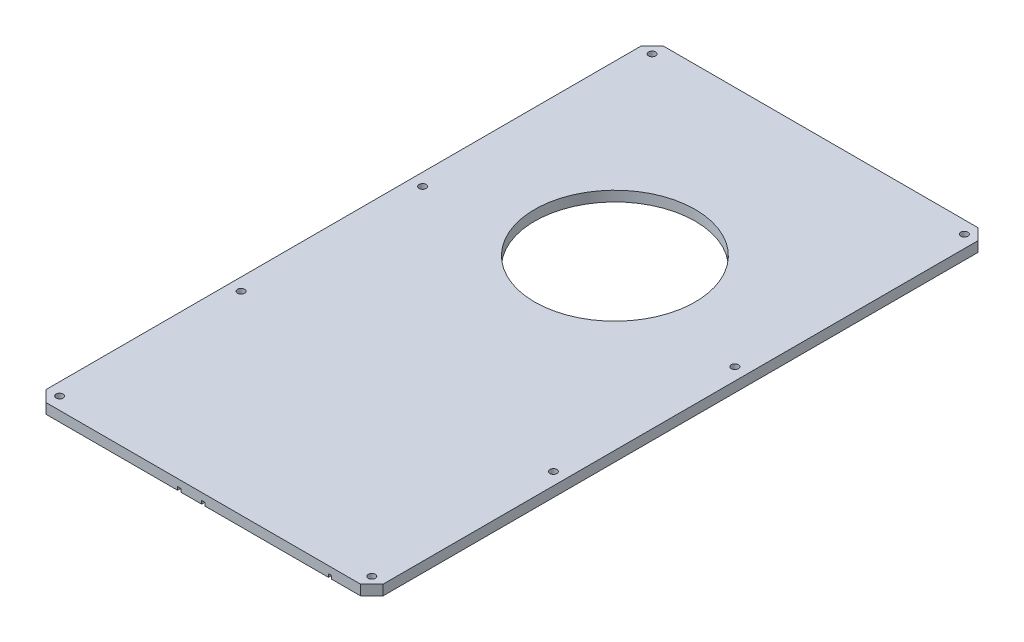
from build123d import *

# Parameters (mm, degrees)
SKETCH1_W               = 105
SKETCH1_H               = 192.3454
BOSS_EXTRUDE1_DEPTH     = 3.175
CHAMFER1_SIZE           = 3.5
SKETCH2_R               = 25
CUT_EXTRUDE1_DEPTH      = 110.615322151
CUT_EXTRUDE_THIN1_START = -1
CUT_EXTRUDE_THIN1_DEPTH = 1
CUT_EXTRUDE2_DEPTH      = 1
SKETCH6_R               = 1.1
CUT_EXTRUDE3_DEPTH      = 110.615322151
CHAMFER2_SIZE           = 1.1


# Read off the part's stored shape, not the designer's step: Cut-Extrude-Thin1
with BuildPart() as part:
    # Sketch1 → Boss-Extrude1 (new body)
    with BuildSketch(Plane(origin=(0, 0, 0), x_dir=(1, 0, 0), z_dir=(0, 1, 0))):
        Rectangle(SKETCH1_W, SKETCH1_H)
    extrude(amount=BOSS_EXTRUDE1_DEPTH)

    # Chamfer1
    chamfer1_edges = [part.edges().sort_by_distance(p)[0] for p in [
        (-52.5, 1.5875, -96.1727),
        (52.5, 1.5875, -96.1727),
        (52.5, 1.5875, 96.1727),
        (-52.5, 1.5875, 96.1727),
    ]]
    chamfer(chamfer1_edges, length=CHAMFER1_SIZE)

    # Sketch2 → Cut-Extrude1 (cut, through all)
    with BuildSketch(Plane.XZ):
        with Locations(Location((0, -32.057566667, 0), (0, 0, 270))):
            Circle(SKETCH2_R)
    extrude(amount=-CUT_EXTRUDE1_DEPTH, mode=Mode.SUBTRACT)

    # Cut-Extrude-Thin1 outline → Cut-Extrude-Thin1 (cut)
    # profile 1 of 2: a face of its own
    with BuildSketch(Plane(origin=(0, 0, 0), x_dir=(-1, 0, 0), z_dir=(0, -1, 0)).offset(CUT_EXTRUDE_THIN1_START)):
        with BuildLine():
            Line((-0.5, 7.062567167), (-0.5, -10.4787141))
            ThreePointArc((-0.5, -10.4787141), (-6.237149669, -19.303333464), (-7.980739941, -29.683539926))
            ThreePointArc((-7.980739941, -29.683539926), (0, -26.804235846), (7.980739941, -29.683539926))
            ThreePointArc((7.980739941, -29.683539926), (6.237149669, -19.303333464), (0.5, -10.4787141))
            Line((0.5, -10.4787141), (0.5, 7.062567167))
            ThreePointArc((0.5, 7.062567167), (0, 7.057566667), (-0.5, 7.062567167))
        make_face()
        with BuildLine():
            ThreePointArc((0, -11.397130906), (5.003923805, -18.927747814), (6.982377972, -27.750171719))
            ThreePointArc((6.982377972, -27.750171719), (0, -25.804235846), (-6.982377972, -27.750171719))
            ThreePointArc((-6.982377972, -27.750171719), (-5.003923805, -18.927747814), (0, -11.397130906))
        make_face(mode=Mode.SUBTRACT)
    # profile 2 of 2: a face of its own
    with BuildSketch(Plane(origin=(0, 0, 0), x_dir=(-1, 0, 0), z_dir=(0, -1, 0)).offset(CUT_EXTRUDE_THIN1_START)):
        with BuildLine():
            ThreePointArc((-3.461538462, -73.83767702), (-2.032623324, -72.965633547), (-0.5, -72.292340123))
            Line((-0.5, -72.292340123), (-0.5, -96.1727))
            Line((-0.5, -96.1727), (0.5, -96.1727))
            Line((0.5, -96.1727), (0.5, -89.050988889))
            Line((0.5, -89.050988889), (5.5, -89.050988889))
            Line((5.5, -89.050988889), (5.5, -88.050988889))
            Line((5.5, -88.050988889), (0.5, -88.050988889))
            Line((0.5, -88.050988889), (0.5, -71.977550364))
            ThreePointArc((0.5, -71.977550364), (3.75, -71.547658069), (7, -71.977550364))
            Line((7, -71.977550364), (7, -96.1727))
            Line((7, -96.1727), (8, -96.1727))
            Line((8, -96.1727), (8, -81.550988889))
            Line((8, -81.550988889), (32.5, -81.550988889))
            Line((32.5, -81.550988889), (32.5, 13.3273))
            Line((32.5, 13.3273), (39, 13.3273))
            Line((39, 13.3273), (39, -88.050988889))
            Line((39, -88.050988889), (9.5, -88.050988889))
            Line((9.5, -88.050988889), (9.5, -89.050988889))
            Line((9.5, -89.050988889), (40, -89.050988889))
            Line((40, -89.050988889), (40, 13.3273))
            Line((40, 13.3273), (43.75, 13.3273))
            Line((43.75, 13.3273), (43.75, 24.3273))
            ThreePointArc((43.75, 24.3273), (41.580951895, 29.804525575), (36.25, 32.311659711))
            Line((36.25, 32.311659711), (36.25, 63.444142327))
            Line((36.25, 63.444142327), (4.25, 63.444142327))
            Line((4.25, 63.444142327), (4.25, 68.752070988))
            ThreePointArc((4.25, 68.752070988), (6.207809813, 67.846319731), (7.980739941, 66.617448963))
            ThreePointArc((7.980739941, 66.617448963), (6.237149669, 76.997655425), (0.5, 85.822274789))
            Line((0.5, 85.822274789), (0.5, 96.1727))
            Line((0.5, 96.1727), (-0.5, 96.1727))
            Line((-0.5, 96.1727), (-0.5, 85.822274789))
            ThreePointArc((-0.5, 85.822274789), (-6.237149669, 76.997655425), (-7.980739941, 66.617448963))
            ThreePointArc((-7.980739941, 66.617448963), (-6.207809813, 67.846319731), (-4.25, 68.752070988))
            Line((-4.25, 68.752070988), (-4.25, 63.444142327))
            Line((-4.25, 63.444142327), (-36.25, 63.444142327))
            Line((-36.25, 63.444142327), (-36.25, 32.311659711))
            ThreePointArc((-36.25, 32.311659711), (-41.580951895, 29.804525575), (-43.75, 24.3273))
            Line((-43.75, 24.3273), (-43.75, 13.3273))
            Line((-43.75, 13.3273), (-40, 13.3273))
            Line((-40, 13.3273), (-40, -96.1727))
            Line((-40, -96.1727), (-39, -96.1727))
            Line((-39, -96.1727), (-39, -38.185855556))
            Line((-39, -38.185855556), (-3.25, -38.185855556))
            Line((-3.25, -38.185855556), (-3.25, -29.234128142))
            ThreePointArc((-3.25, -29.234128142), (0, -28.804235846), (3.25, -29.234128142))
            Line((3.25, -29.234128142), (3.25, -44.685855556))
            Line((3.25, -44.685855556), (-31.5, -44.685855556))
            Line((-31.5, -44.685855556), (-31.5, -39.685855556))
            Line((-31.5, -39.685855556), (-32.5, -39.685855556))
            Line((-32.5, -39.685855556), (-32.5, -45.685855556))
            Line((-32.5, -45.685855556), (3.25, -45.685855556))
            Line((3.25, -45.685855556), (3.25, -53.222136322))
            ThreePointArc((3.25, -53.222136322), (-2.487149669, -62.046755686), (-4.230739941, -72.426962148))
            ThreePointArc((-4.230739941, -72.426962148), (3.75, -69.547658069), (11.730739941, -72.426962148))
            ThreePointArc((11.730739941, -72.426962148), (9.987149669, -62.046755686), (4.25, -53.222136322))
            Line((4.25, -53.222136322), (4.25, -29.548917901))
            ThreePointArc((4.25, -29.548917901), (5.782623324, -30.222211325), (7.211538462, -31.094254798))
            Line((7.211538462, -31.094254798), (7.788461538, -30.277456314))
            ThreePointArc((7.788461538, -30.277456314), (0, -27.804235846), (-7.788461538, -30.277456314))
            Line((-7.788461538, -30.277456314), (-7.211538462, -31.094254798))
            ThreePointArc((-7.211538462, -31.094254798), (-5.782623324, -30.222211325), (-4.25, -29.548917901))
            Line((-4.25, -29.548917901), (-4.25, -37.185855556))
            Line((-4.25, -37.185855556), (-39, -37.185855556))
            Line((-39, -37.185855556), (-39, 13.3273))
            Line((-39, 13.3273), (-32.5, 13.3273))
            Line((-32.5, 13.3273), (-32.5, -35.685855556))
            Line((-32.5, -35.685855556), (-31.5, -35.685855556))
            Line((-31.5, -35.685855556), (-31.5, 13.3273))
            Line((-31.5, 13.3273), (-27.75, 13.3273))
            Line((-27.75, 13.3273), (-27.75, 24.3273))
            ThreePointArc((-27.75, 24.3273), (-29.919048105, 29.804525575), (-35.25, 32.311659711))
            Line((-35.25, 32.311659711), (-35.25, 62.444142327))
            Line((-35.25, 62.444142327), (-3.25, 62.444142327))
            Line((-3.25, 62.444142327), (-3.25, 69.066860747))
            ThreePointArc((-3.25, 69.066860747), (0, 69.496753043), (3.25, 69.066860747))
            Line((3.25, 69.066860747), (3.25, 62.444142327))
            Line((3.25, 62.444142327), (35.25, 62.444142327))
            Line((35.25, 62.444142327), (35.25, 32.311659711))
            ThreePointArc((35.25, 32.311659711), (29.919048105, 29.804525575), (27.75, 24.3273))
            Line((27.75, 24.3273), (27.75, 13.3273))
            Line((27.75, 13.3273), (31.5, 13.3273))
            Line((31.5, 13.3273), (31.5, -80.550988889))
            Line((31.5, -80.550988889), (8, -80.550988889))
            Line((8, -80.550988889), (8, -72.292340123))
            ThreePointArc((8, -72.292340123), (9.532623324, -72.965633547), (10.961538462, -73.83767702))
            Line((10.961538462, -73.83767702), (11.538461538, -73.020878536))
            ThreePointArc((11.538461538, -73.020878536), (3.75, -70.547658069), (-4.038461538, -73.020878536))
            Line((-4.038461538, -73.020878536), (-3.461538462, -73.83767702))
        make_face()
        with BuildLine():
            ThreePointArc((3.75, -54.140553128), (8.753923805, -61.671170036), (10.732377972, -70.493593942))
            ThreePointArc((10.732377972, -70.493593942), (3.75, -68.547658069), (-3.232377972, -70.493593942))
            ThreePointArc((-3.232377972, -70.493593942), (-1.253923805, -61.671170036), (3.75, -54.140553128))
        make_face(mode=Mode.SUBTRACT)
        with BuildLine():
            Line((-28.75, 14.3273), (-42.75, 14.3273))
            Line((-42.75, 14.3273), (-42.75, 24.3273))
            ThreePointArc((-42.75, 24.3273), (-35.75, 31.3273), (-28.75, 24.3273))
            Line((-28.75, 24.3273), (-28.75, 14.3273))
        make_face(mode=Mode.SUBTRACT)
        with BuildLine():
            ThreePointArc((28.75, 24.3273), (35.75, 31.3273), (42.75, 24.3273))
            Line((42.75, 24.3273), (42.75, 14.3273))
            Line((42.75, 14.3273), (28.75, 14.3273))
            Line((28.75, 14.3273), (28.75, 24.3273))
        make_face(mode=Mode.SUBTRACT)
        with BuildLine():
            ThreePointArc((0, 84.903857983), (5.003923805, 77.373241075), (6.982377972, 68.55081717))
            ThreePointArc((6.982377972, 68.55081717), (0, 70.496753043), (-6.982377972, 68.55081717))
            ThreePointArc((-6.982377972, 68.55081717), (-5.003923805, 77.373241075), (0, 84.903857983))
        make_face(mode=Mode.SUBTRACT)
    extrude(amount=CUT_EXTRUDE_THIN1_DEPTH, mode=Mode.SUBTRACT)

    # Sketch4 → Cut-Extrude2 (cut)
    with BuildSketch(Plane.XZ):
        with BuildLine():
            Line((-10.5, 88.050988889), (-9.5, 88.050988889))
            ThreePointArc((-9.5, 88.050988889), (-7.5, 86.050988889), (-5.5, 88.050988889))
            Line((-5.5, 88.050988889), (-4.5, 88.050988889))
            ThreePointArc((-4.5, 88.050988889), (-7.5, 85.050988889), (-10.5, 88.050988889))
        make_face()
        with BuildLine():
            Line((31.5, 35.685855556), (31.5, 34.685855556))
            ThreePointArc((31.5, 34.685855556), (28.5, 37.685855556), (31.5, 40.685855556))
            Line((31.5, 40.685855556), (31.5, 39.685855556))
            ThreePointArc((31.5, 39.685855556), (29.5, 37.685855556), (31.5, 35.685855556))
        make_face()
    extrude(amount=-CUT_EXTRUDE2_DEPTH, mode=Mode.SUBTRACT)

    # Sketch6 → Cut-Extrude3 (cut, through all)
    with BuildSketch(Plane.XZ):
        with Locations(Location((48.628679656, -20.801379656, 0), (0, 0, 270))):
            Circle(SKETCH6_R)
        with Locations(Location((-48.628679656, 92.301379656, 0), (0, 0, 270))):
            Circle(SKETCH6_R)
        with Locations(Location((-48.628679656, 35.75, 0), (0, 0, 270))):
            Circle(SKETCH6_R)
        with Locations(Location((-48.628679656, -20.801379656, 0), (0, 0, 270))):
            Circle(SKETCH6_R)
        with Locations(Location((-48.628679656, -92.301379656, 0), (0, 0, 270))):
            Circle(SKETCH6_R)
        with Locations(Location((48.628679656, -92.301379656, 0), (0, 0, 270))):
            Circle(SKETCH6_R)
        with Locations(Location((48.628679656, 35.75, 0), (0, 0, 270))):
            Circle(SKETCH6_R)
        with Locations(Location((48.628679656, 92.301379656, 0), (0, 0, 270))):
            Circle(SKETCH6_R)
    extrude(amount=-CUT_EXTRUDE3_DEPTH, mode=Mode.SUBTRACT)

    # Chamfer2
    chamfer2_edges = [part.edges().sort_by_distance(p)[0] for p in [
        (48.628679656, 0, 93.401379656),
        (48.628679656, 0, 36.85),
        (48.628679656, 0, -91.201379656),
        (-48.628679656, 0, -91.201379656),
        (-48.628679656, 0, -19.701379656),
        (-48.628679656, 0, 36.85),
        (-48.628679656, 0, 93.401379656),
        (48.628679656, 0, -19.701379656),
    ]]
    chamfer(chamfer2_edges, length=CHAMFER2_SIZE)


solid = part.part
